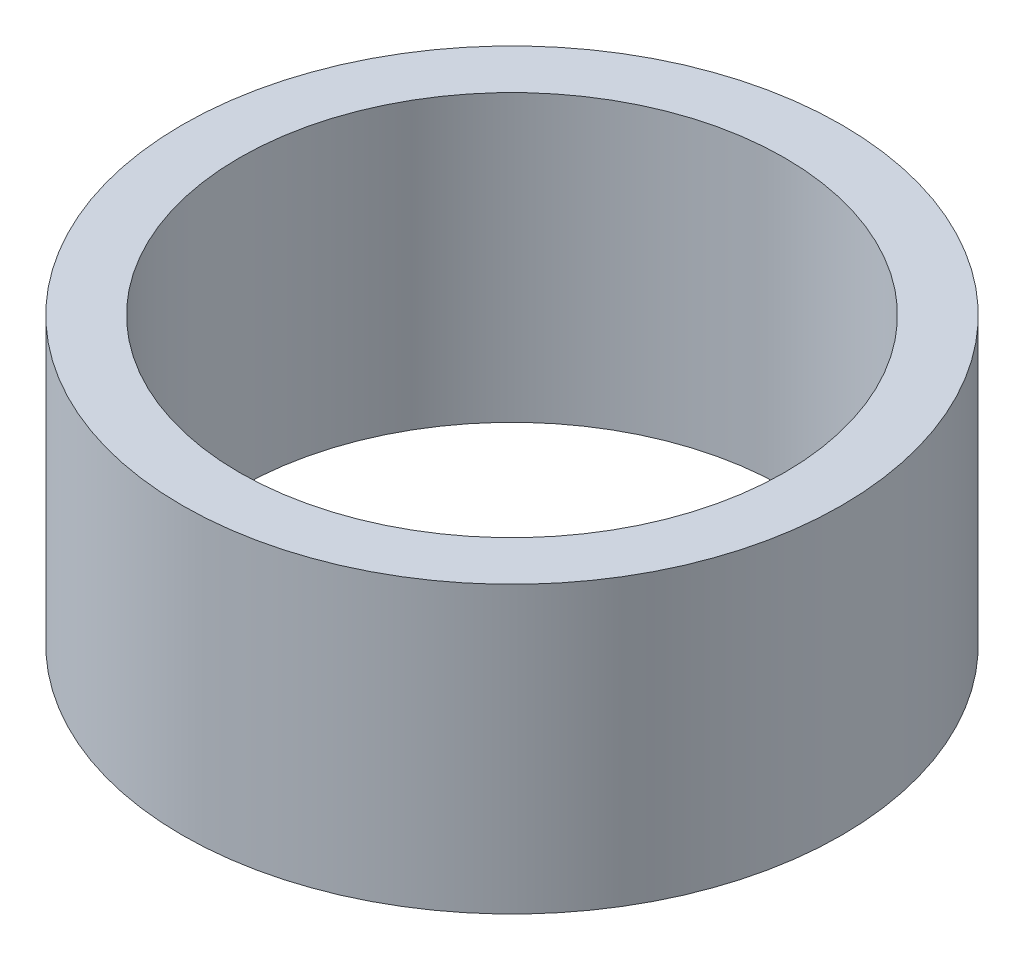
from build123d import *

# Parameters (mm, degrees)
SKETCH_1_R      = 6.35
SKETCH_1_R_2    = 5.25
EXTRUDE_1_DEPTH = 5.5


with BuildPart() as part:
    # Эскиз1 → Бобышка-Вытянуть1 (new body)
    with BuildSketch(Plane(origin=(0, 0, 0), x_dir=(1, 0, 0), z_dir=(0, 1, 0))):
        Circle(SKETCH_1_R)
        Circle(SKETCH_1_R_2, mode=Mode.SUBTRACT)
    extrude(amount=EXTRUDE_1_DEPTH)


solid = part.part
